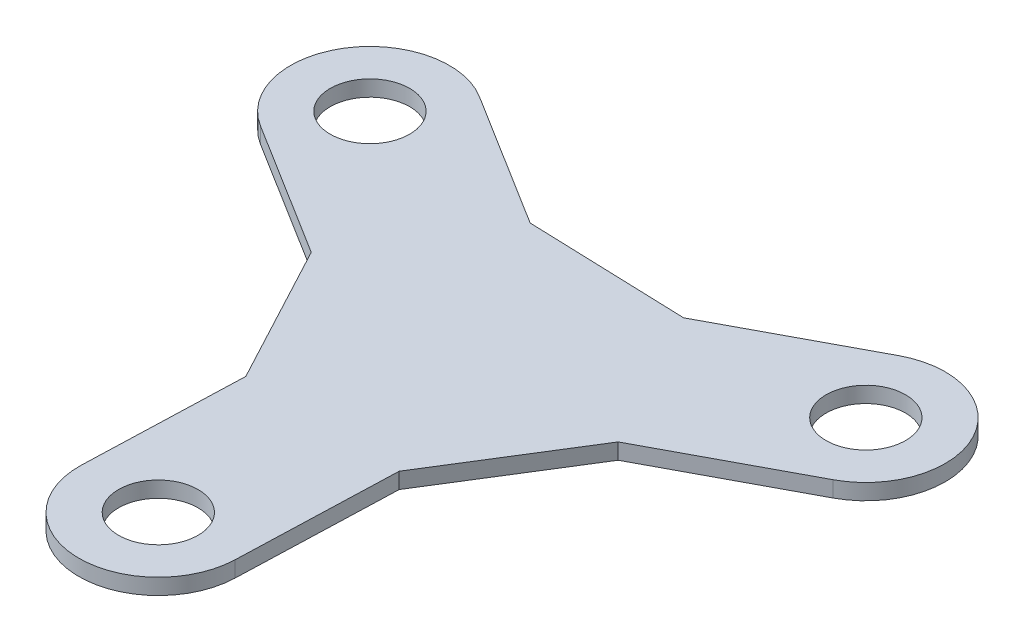
from build123d import *

# Parameters (mm, degrees)
BASE_FLANGE1_DEPTH = 2
SKETCH9_R          = 5
TAB1_DEPTH         = 2


# Sheet-metal steps are written as plain solids
with BuildPart() as part:
    # Sketch1 → Base-Flange1 (new body)
    with BuildSketch(Plane(origin=(0, 0, 0), x_dir=(1, 0, 0), z_dir=(0, 1, 0))):
        Polygon((10.580822677, 16.971923623), (-9.40770567, 17.649223043), (-19.988528347, 0.67729942), (-10.580822677, -16.971923623), (9.40770567, -17.649223043), (19.988528347, -0.67729942), align=None)
    extrude(amount=-BASE_FLANGE1_DEPTH)

    # Sketch9 → Tab1 (add)
    # profile 1 of 3: a face of its own
    with BuildSketch(Plane.XZ.offset(2)):
        with BuildLine():
            Line((-10.580822677, 16.971923623), (-11.258122097, 36.960451971))
            ThreePointArc((-11.258122097, 36.960451971), (-1.602507633, 47.293365854), (8.73040625, 37.63775139))
            Line((8.73040625, 37.63775139), (9.40770567, 17.649223043))
            Line((9.40770567, 17.649223043), (-10.580822677, 16.971923623))
        make_face()
        with Locations(Location((-1.263857923, 37.299101681, 0), (0, 0, 270))):
            Circle(SKETCH9_R, mode=Mode.SUBTRACT)
    # profile 2 of 3: a face of its own
    with BuildSketch(Plane.XZ.offset(2)):
        with BuildLine():
            Line((19.988528347, 0.67729942), (37.63775139, -8.73040625))
            ThreePointArc((37.63775139, -8.73040625), (41.758510077, -22.258870607), (28.23004572, -26.379629293))
            Line((28.23004572, -26.379629293), (10.580822677, -16.971923623))
            Line((10.580822677, -16.971923623), (19.988528347, 0.67729942))
        make_face()
        with Locations(Location((32.933898555, -17.555017772, 0), (0, 0, 270))):
            Circle(SKETCH9_R, mode=Mode.SUBTRACT)
    # profile 3 of 3: a face of its own
    with BuildSketch(Plane.XZ.offset(2)):
        with BuildLine():
            Line((-9.40770567, -17.649223043), (-26.379629293, -28.23004572))
            ThreePointArc((-26.379629293, -28.23004572), (-40.156002444, -25.034495247), (-36.960451971, -11.258122097))
            Line((-36.960451971, -11.258122097), (-19.988528347, -0.67729942))
            Line((-19.988528347, -0.67729942), (-9.40770567, -17.649223043))
        make_face()
        with Locations(Location((-31.670040632, -19.744083909, 0), (0, 0, 270))):
            Circle(SKETCH9_R, mode=Mode.SUBTRACT)
    extrude(amount=-TAB1_DEPTH)


solid = part.part
